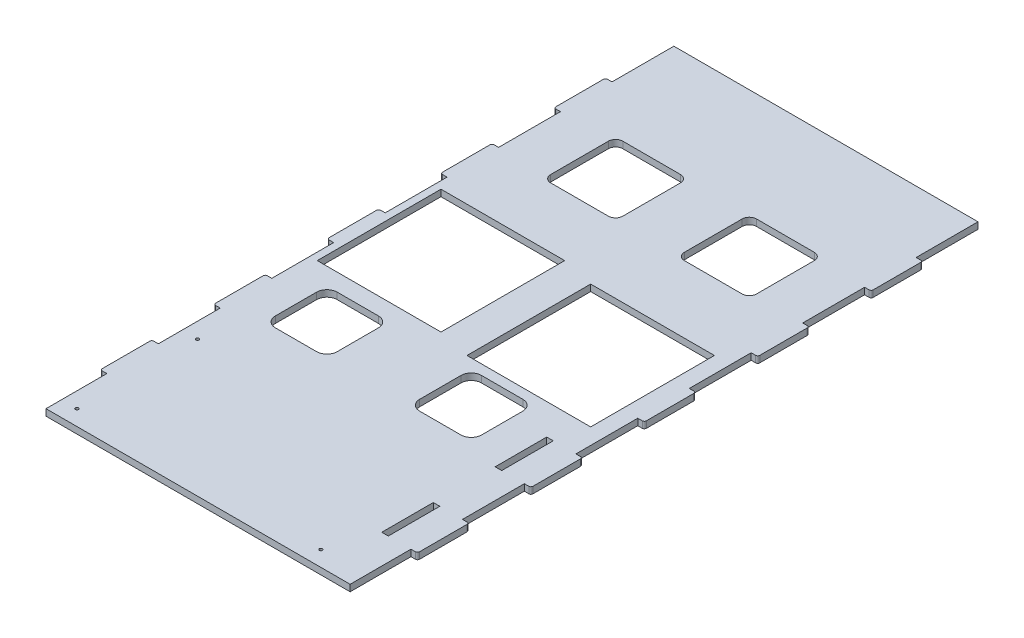
from build123d import *

# Parameters (mm, degrees)
BOSS_EXTRUDE1_DEPTH = 6.35
FILLET1_R           = 2
SKETCH2_R           = 1.5
SKETCH2_W           = 6.35
SKETCH2_H           = 50
SKETCH2_W_2         = 120
SKETCH2_H_2         = 120
CUT_EXTRUDE1_DEPTH  = 6.35


with BuildPart() as part:
    # Sketch1 → Boss-Extrude1 (new body)
    with BuildSketch(Plane(origin=(0, 0, 0), x_dir=(1, 0, 0), z_dir=(0, 1, 0))):
        Polygon((0, 0), (295, 0), (295, 59), (301.35, 59), (301.35, 109), (295, 109), (295, 169), (301.35, 169), (301.35, 219), (295, 219), (295, 279), (301.35, 279), (301.35, 329), (295, 329), (295, 389), (301.35, 389), (301.35, 439), (295, 439), (295, 499), (301.35, 499), (301.35, 549), (295, 549), (295, 609), (0, 609), (0, 549), (-6.35, 549), (-6.35, 499), (0, 499), (0, 439), (-6.35, 439), (-6.35, 389), (0, 389), (0, 329), (-6.35, 329), (-6.35, 279), (0, 279), (0, 219), (-6.35, 219), (-6.35, 169), (0, 169), (0, 109), (-6.35, 109), (-6.35, 59), (0, 59), align=None)
    extrude(amount=BOSS_EXTRUDE1_DEPTH)

    # Fillet1
    fillet1_edges = [part.edges().sort_by_distance(p)[0] for p in [
        (301.35, 3.175, -549),
        (301.35, 3.175, -499),
        (301.35, 3.175, -439),
        (301.35, 3.175, -389),
        (301.35, 3.175, -329),
        (301.35, 3.175, -279),
        (301.35, 3.175, -219),
        (301.35, 3.175, -169),
        (301.35, 3.175, -109),
        (301.35, 3.175, -59),
        (-6.35, 3.175, -59),
        (-6.35, 3.175, -109),
        (-6.35, 3.175, -169),
        (-6.35, 3.175, -219),
        (-6.35, 3.175, -279),
        (-6.35, 3.175, -329),
        (-6.35, 3.175, -389),
        (-6.35, 3.175, -439),
        (-6.35, 3.175, -499),
        (-6.35, 3.175, -549),
    ]]
    fillet(fillet1_edges, radius=FILLET1_R)

    # Sketch2 → Cut-Extrude1 (cut)
    with BuildSketch(Plane(origin=(0, 6.35, 0), x_dir=(1, 0, 0), z_dir=(0, 1, 0))):
        with Locations((15, 15)):
            Circle(SKETCH2_R)
        with Locations((251.65, 15)):
            Circle(SKETCH2_R)
        with Locations((15, 131.925897501)):
            Circle(SKETCH2_R)
        with Locations((269.825, 194)):
            Rectangle(SKETCH2_W, SKETCH2_H)
        with Locations((269.825, 84)):
            Rectangle(SKETCH2_W, SKETCH2_H)
        with BuildLine():
            Line((55.042435698, 504.435466218), (111.042435698, 504.435466218))
            ThreePointArc((111.042435698, 504.435466218), (115.992183166, 502.385213686), (118.042435698, 497.435466218))
            Line((118.042435698, 497.435466218), (118.042435698, 441.435466218))
            ThreePointArc((118.042435698, 441.435466218), (115.992183166, 436.48571875), (111.042435698, 434.435466218))
            Line((111.042435698, 434.435466218), (55.042435698, 434.435466218))
            ThreePointArc((55.042435698, 434.435466218), (50.09268823, 436.48571875), (48.042435698, 441.435466218))
            Line((48.042435698, 441.435466218), (48.042435698, 497.435466218))
            ThreePointArc((48.042435698, 497.435466218), (50.09268823, 502.385213686), (55.042435698, 504.435466218))
        make_face()
        with BuildLine():
            Line((185.233522799, 503.969461472), (241.233522799, 503.969461472))
            ThreePointArc((241.233522799, 503.969461472), (246.183270267, 501.91920894), (248.233522799, 496.969461472))
            Line((248.233522799, 496.969461472), (248.233522799, 440.969461472))
            ThreePointArc((248.233522799, 440.969461472), (246.183270267, 436.019714004), (241.233522799, 433.969461472))
            Line((241.233522799, 433.969461472), (185.233522799, 433.969461472))
            ThreePointArc((185.233522799, 433.969461472), (180.283775331, 436.019714004), (178.233522799, 440.969461472))
            Line((178.233522799, 440.969461472), (178.233522799, 496.969461472))
            ThreePointArc((178.233522799, 496.969461472), (180.283775331, 501.91920894), (185.233522799, 503.969461472))
        make_face()
        with BuildLine():
            Line((43.325, 239.143159068), (83.325, 239.143159068))
            ThreePointArc((83.325, 239.143159068), (90.396067812, 236.21422688), (93.325, 229.143159068))
            Line((93.325, 229.143159068), (93.325, 189.143159068))
            ThreePointArc((93.325, 189.143159068), (90.396067812, 182.072091256), (83.325, 179.143159068))
            Line((83.325, 179.143159068), (43.325, 179.143159068))
            ThreePointArc((43.325, 179.143159068), (36.253932188, 182.072091256), (33.325, 189.143159068))
            Line((33.325, 189.143159068), (33.325, 229.143159068))
            ThreePointArc((33.325, 229.143159068), (36.253932188, 236.21422688), (43.325, 239.143159068))
        make_face()
        with Locations((67.172717051, 315.936047475)):
            Rectangle(SKETCH2_W_2, SKETCH2_H_2)
        with Locations((219.464803824, 308.834923652)):
            Rectangle(SKETCH2_W_2, SKETCH2_H_2)
        with BuildLine():
            Line((173.325, 229.143159068), (173.325, 189.143159068))
            ThreePointArc((173.325, 189.143159068), (176.253932188, 182.072091256), (183.325, 179.143159068))
            Line((183.325, 179.143159068), (223.325, 179.143159068))
            ThreePointArc((223.325, 179.143159068), (230.396067812, 182.072091256), (233.325, 189.143159068))
            Line((233.325, 189.143159068), (233.325, 229.143159068))
            ThreePointArc((233.325, 229.143159068), (230.396067812, 236.21422688), (223.325, 239.143159068))
            Line((223.325, 239.143159068), (183.325, 239.143159068))
            ThreePointArc((183.325, 239.143159068), (176.253932188, 236.21422688), (173.325, 229.143159068))
        make_face()
    extrude(amount=-CUT_EXTRUDE1_DEPTH, mode=Mode.SUBTRACT)


solid = part.part
